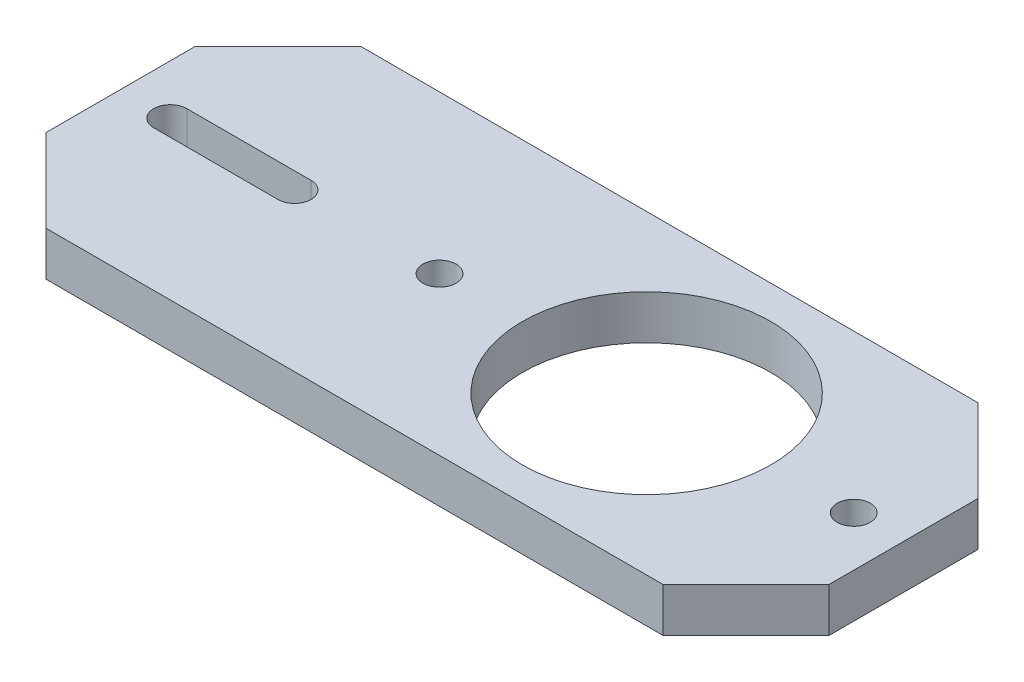
from build123d import *

# Parameters (mm, degrees)
SKETCH1_R           = 2
SKETCH1_R_2         = 15
BOSS_EXTRUDE1_DEPTH = 5.333


with BuildPart() as part:
    # Sketch1 → Boss-Extrude1 (new body)
    with BuildSketch(Plane(origin=(0, 0, 0), x_dir=(1, 0, 0), z_dir=(0, 1, 0))):
        Polygon((-63.5, 9), (-53.5, 19), (21, 19), (31, 9), (31, -9), (21, -19), (-53.5, -19), (-63.5, -9), align=None)
        with Locations((-25, 0)):
            Circle(SKETCH1_R, mode=Mode.SUBTRACT)
        with Locations((25, 0)):
            Circle(SKETCH1_R, mode=Mode.SUBTRACT)
        Circle(SKETCH1_R_2, mode=Mode.SUBTRACT)
        with BuildLine():
            Line((-57.5, 2), (-42.5, 2))
            ThreePointArc((-42.5, 2), (-40.5, 0), (-42.5, -2))
            Line((-42.5, -2), (-57.5, -2))
            ThreePointArc((-57.5, -2), (-59.5, 0), (-57.5, 2))
        make_face(mode=Mode.SUBTRACT)
    extrude(amount=-BOSS_EXTRUDE1_DEPTH)


solid = part.part
